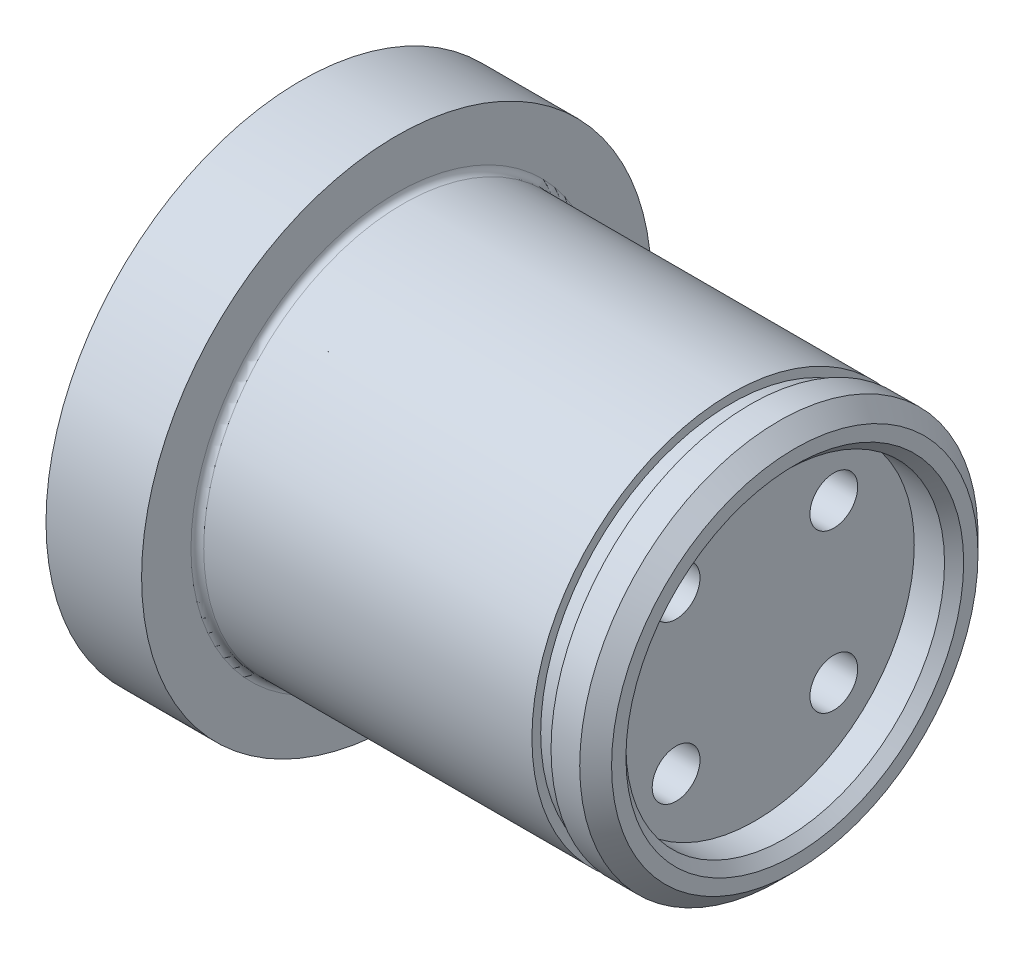
from build123d import *

# Parameters (mm, degrees)
SKETCH_2_W               = 1.2
SKETCH_2_H               = 0.55
CHAMFER_1_SIZE           = 1
FILLET_1_R               = 0.4
HOLE_WIZARD_1_D          = 3
PATTERN_CIRCULAR_1_COUNT = 4
SKETCH_5_W               = 2.5
SKETCH_5_H               = 10
CHAMFER_2_SIZE           = 0.6


with BuildPart() as part:
    # Эскиз1 → Повернуть1 (revolve)
    with BuildSketch(Plane.XY):
        Polygon((0, 0), (0, 12.5), (-25, 12.5), (-25, 16), (-31, 16), (-31, 0), align=None)
    revolve(axis=Axis((0, 0, 0), (1, 0, 0)))

    # Эскиз2 → Вырез-Повернуть1 (revolve, cut)
    with BuildSketch(Plane.XY):
        with Locations((-3.4, 12.225)):
            Rectangle(SKETCH_2_W, SKETCH_2_H)
    revolve(axis=Axis((0, 0, 0), (-1, 0, 0)), mode=Mode.SUBTRACT)

    # Фаска1
    chamfer_1_edges = [part.edges().sort_by_distance(p)[0] for p in [
        (0, -12.5, 0),
    ]]
    chamfer(chamfer_1_edges, length=CHAMFER_1_SIZE)

    # Скругление1
    fillet_1_edges = [part.edges().sort_by_distance(p)[0] for p in [
        (-25, -12.5, 0),
    ]]
    fillet(fillet_1_edges, radius=FILLET_1_R)

    # Отверстие1 (through all)
    with Locations(Plane(origin=(0, 0, 0), x_dir=(0, 0, -1), z_dir=(1, 0, 0))):
        with Locations((4.949747468, 4.949747468)):
            hole_wizard_1 = Hole(HOLE_WIZARD_1_D / 2)

    # Круговой массив1: Отверстие1 ×4 about axis
    pattern_circular_1_axis = Axis((0, 0, 0), (-1, 0, 0))
    for i in range(1, PATTERN_CIRCULAR_1_COUNT):
        add(hole_wizard_1.rotate(pattern_circular_1_axis, i * 360 / PATTERN_CIRCULAR_1_COUNT), mode=Mode.SUBTRACT)

    # Эскиз5 → Вырез-Повернуть2 (revolve, cut)
    with BuildSketch(Plane.XY):
        with Locations((-1.25, 5)):
            Rectangle(SKETCH_5_W, SKETCH_5_H)
    revolve(axis=Axis((0, 0, 0), (-1, 0, 0)), mode=Mode.SUBTRACT)

    # Фаска2
    chamfer_2_edges = [part.edges().sort_by_distance(p)[0] for p in [
        (0, -10, 0),
    ]]
    chamfer(chamfer_2_edges, length=CHAMFER_2_SIZE)


solid = part.part
